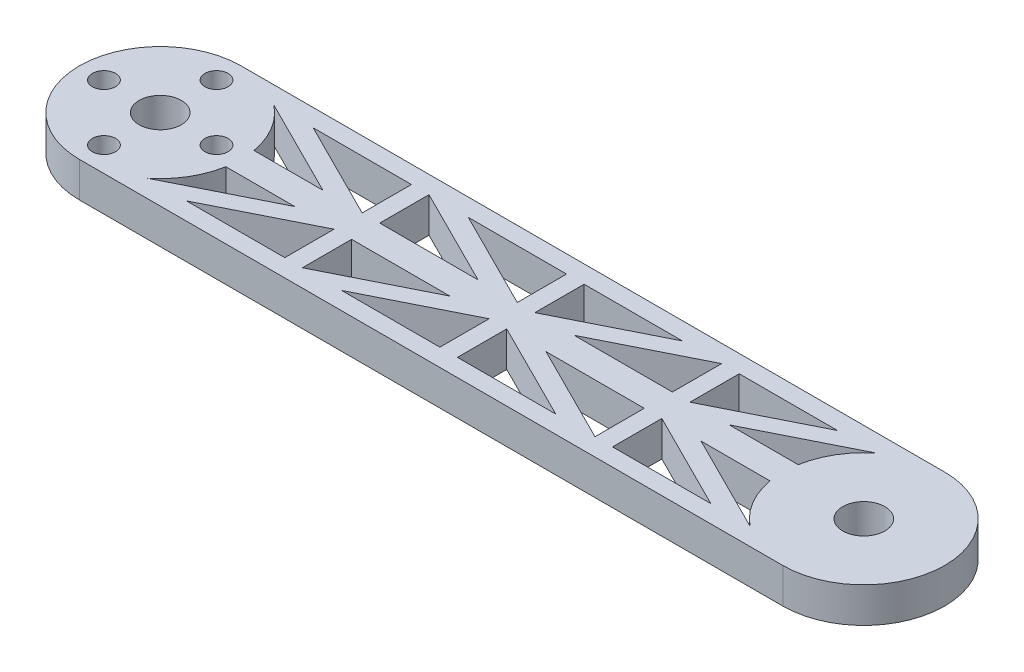
from build123d import *

# Parameters (mm, degrees)
SKETCH1_R           = 1.65
SKETCH1_R_2         = 3
BOSS_EXTRUDE1_DEPTH = 5
CUT_EXTRUDE1_START  = -5
CUT_EXTRUDE1_DEPTH  = 5


with BuildPart() as part:
    # Sketch1 → Boss-Extrude1 (new body)
    with BuildSketch(Plane(origin=(0, 0, 0), x_dir=(1, 0, 0), z_dir=(0, 1, 0))):
        with BuildLine():
            Line((-50, 11.5), (50, 11.5))
            ThreePointArc((50, 11.5), (61.5, 0), (50, -11.5))
            Line((50, -11.5), (-50, -11.5))
            ThreePointArc((-50, -11.5), (-61.5, 0), (-50, 11.5))
        make_face()
        with Locations((-50, 8)):
            Circle(SKETCH1_R, mode=Mode.SUBTRACT)
        with Locations((-42, 0)):
            Circle(SKETCH1_R, mode=Mode.SUBTRACT)
        with Locations((-50, -8)):
            Circle(SKETCH1_R, mode=Mode.SUBTRACT)
        with Locations((-58, 0)):
            Circle(SKETCH1_R, mode=Mode.SUBTRACT)
        with Locations((50, 0)):
            Circle(SKETCH1_R_2, mode=Mode.SUBTRACT)
        with Locations((-50, 0)):
            Circle(SKETCH1_R_2, mode=Mode.SUBTRACT)
    extrude(amount=BOSS_EXTRUDE1_DEPTH)

    # Sketch2 → Cut-Extrude1 (cut)
    with BuildSketch(Plane(origin=(0, 5, 0), x_dir=(1, 0, 0), z_dir=(0, 1, 0)).offset(CUT_EXTRUDE1_START)):
        with BuildLine():
            Line((-38.675248347, 2), (-28.87491282, 2))
            Line((-28.87491282, 2), (-42.841089468, 9))
            ThreePointArc((-42.841089468, 9), (-40.117619622, 5.881203794), (-38.675248347, 2))
        make_face()
        Polygon((-37.261721383, 9), (-23.295544734, 2), (-23.295544734, 9), align=None)
        Polygon((-6.829368086, 2), (-20.795544734, 9), (-20.795544734, 2), align=None)
        Polygon((-1.25, 9), (-15.216176648, 9), (-1.25, 2), align=None)
        Polygon((-1.25, -2), (-1.25, -9), (-15.216176648, -9), align=None)
        Polygon((-20.795544734, -2), (-6.829368086, -2), (-20.795544734, -9), align=None)
        Polygon((-23.295544734, -2), (-23.295544734, -9), (-37.261721383, -9), align=None)
        with BuildLine():
            Line((-28.87491282, -2), (-42.841089468, -9))
            ThreePointArc((-42.841089468, -9), (-40.117619622, -5.881203794), (-38.675248347, -2))
            Line((-38.675248347, -2), (-28.87491282, -2))
        make_face()
        Polygon((15.216176648, -9), (1.25, -2), (1.25, -9), align=None)
        Polygon((20.795544734, -9), (20.795544734, -2), (6.829368086, -2), align=None)
        Polygon((37.261721383, -9), (23.295544734, -2), (23.295544734, -9), align=None)
        with BuildLine():
            Line((28.87491282, -2), (42.841089468, -9))
            ThreePointArc((42.841089468, -9), (40.117619622, -5.881203794), (38.675248347, -2))
            Line((38.675248347, -2), (28.87491282, -2))
        make_face()
        with BuildLine():
            Line((28.87491282, 2), (42.841089468, 9))
            ThreePointArc((42.841089468, 9), (40.117619622, 5.881203794), (38.675248347, 2))
            Line((38.675248347, 2), (28.87491282, 2))
        make_face()
        Polygon((23.295544734, 2), (23.295544734, 9), (37.261721383, 9), align=None)
        Polygon((20.795544734, 2), (6.829368086, 2), (20.795544734, 9), align=None)
        Polygon((1.25, 2), (1.25, 9), (15.216176648, 9), align=None)
    extrude(amount=CUT_EXTRUDE1_DEPTH, mode=Mode.SUBTRACT)


solid = part.part
